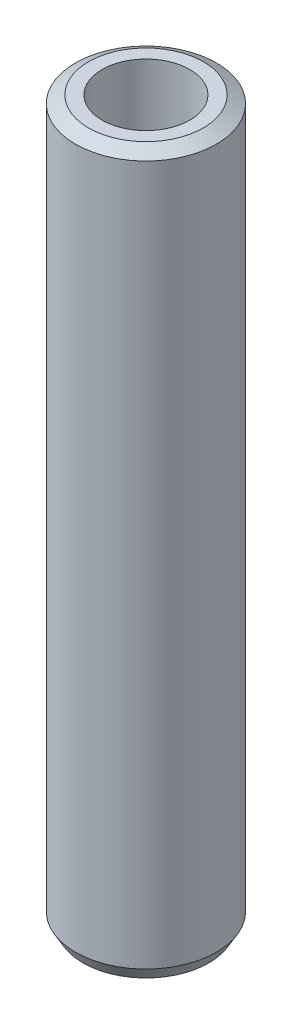
from build123d import *
from OCP.BRepFilletAPI import BRepFilletAPI_MakeChamfer

# Parameters (mm, degrees)
SKETCH1_R           = 40
BOSS_EXTRUDE1_DEPTH = 408.854899428
SKETCH2_R           = 24.902232011
CUT_EXTRUDE1_DEPTH  = 413.749716882
CHAMFER1_SIZE       = 4.287466573
CHAMFER1_SIZE2      = 7.426109939


with BuildPart() as part:
    # Sketch1 → Boss-Extrude1 (new body)
    with BuildSketch(Plane(origin=(0, 0, 0), x_dir=(1, 0, 0), z_dir=(0, 1, 0))):
        Circle(SKETCH1_R)
    extrude(amount=BOSS_EXTRUDE1_DEPTH)

    # Sketch2 → Cut-Extrude1 (cut, through all)
    with BuildSketch(Plane(origin=(0, 0, 0), x_dir=(1, 0, 0), z_dir=(0, 1, 0))):
        Circle(SKETCH2_R)
    extrude(amount=CUT_EXTRUDE1_DEPTH, mode=Mode.SUBTRACT)

    # Chamfer1: one chamfer whose edges measure the first distance from different faces: ONE call of the kernel's chamfer builder (chamfer() names one face for all edges)
    chamfer1_edges_1 = [part.edges().sort_by_distance(p)[0] for p in [
        (-40, 408.854899428, 0),
    ]]
    chamfer1_side_1 = [part.faces().sort_by_distance(p)[0] for p in [
        (-40, 204.427449714, 0),
    ]]
    chamfer1_edges_2 = [part.edges().sort_by_distance(p)[0] for p in [
        (-40, 0, 0),
    ]]
    chamfer1_side_2 = [part.faces().sort_by_distance(p)[0] for p in [
        (-38.86862915, 0, 0),
    ]]
    chamfer1 = BRepFilletAPI_MakeChamfer(part.part.solid().wrapped)
    for e in chamfer1_edges_1:
        chamfer1.Add(CHAMFER1_SIZE, CHAMFER1_SIZE2, e.wrapped, chamfer1_side_1[0].wrapped)  # the first distance lies on this face
    for e in chamfer1_edges_2:
        chamfer1.Add(CHAMFER1_SIZE, CHAMFER1_SIZE2, e.wrapped, chamfer1_side_2[0].wrapped)  # the first distance lies on this face
    add(Compound.cast(chamfer1.Shape()), mode=Mode.REPLACE)


solid = part.part
